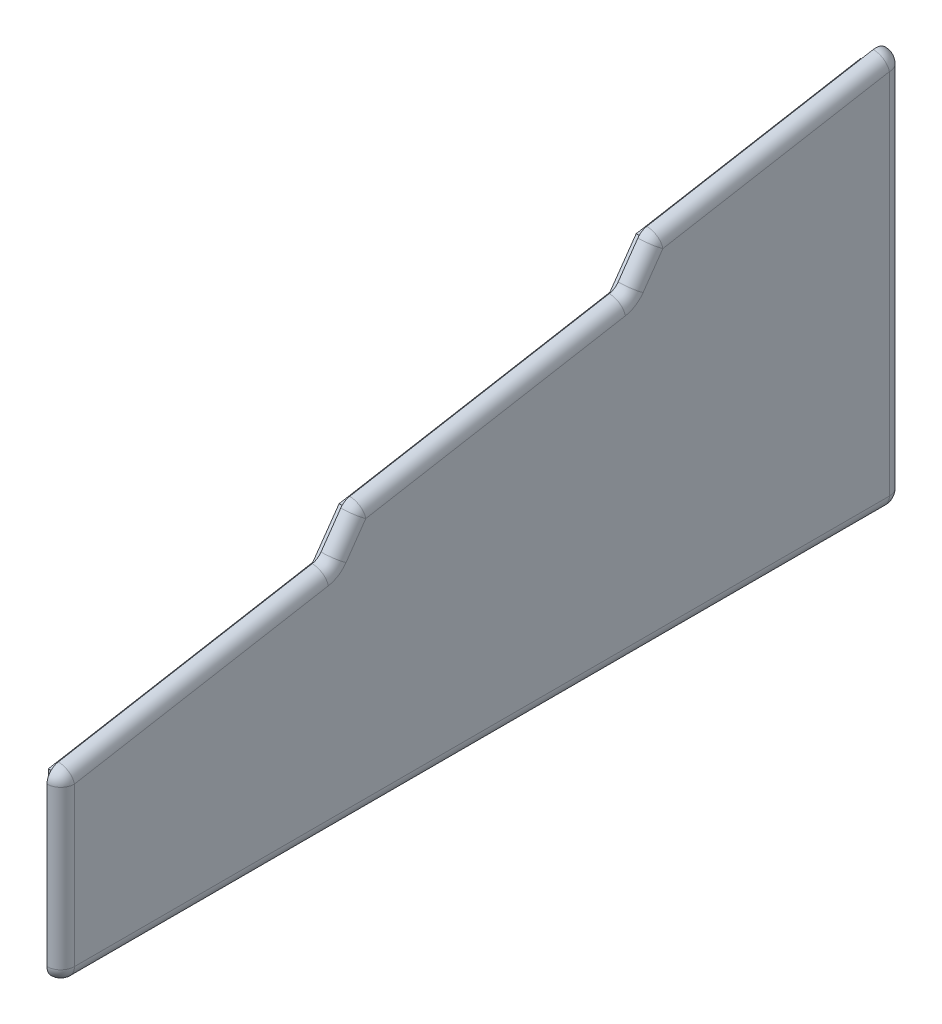
from build123d import *

# Parameters (mm, degrees)
BOSS_EXTRUDE1_DEPTH  = 3
FILLET1_R            = 3
BOSS_EXTRUDE2_DEPTH  = 3
CUT_EXTRUDE1_START   = -16.870694295
CUT_EXTRUDE1_DEPTH   = 17.870694295
CUT_EXTRUDE1_START_2 = 6.082684495
CUT_EXTRUDE1_2_DEPTH = 3.553569774
CUT_EXTRUDE1_START_3 = -94.677172909
CUT_EXTRUDE1_3_DEPTH = 3.677172909
CUT_EXTRUDE2_REACH   = 418.489


with BuildPart() as part:
    # Sketch1 → Boss-Extrude1 (new body)
    with BuildSketch(Plane.ZY.offset(376.423184311)):
        with BuildLine():
            Line((-33.382889261, -4.0880098), (-33.382889261, -11.0880098))
            ThreePointArc((-33.382889261, -11.0880098), (-32.504209605, -13.209330144), (-30.382889261, -14.0880098))
            Line((-30.382889261, -14.0880098), (147.429996243, -14.0880098))
            ThreePointArc((147.429996243, -14.0880098), (149.551316587, -13.209330144), (150.429996243, -11.0880098))
            Line((150.429996243, -11.0880098), (150.429996243, -4.0880098))
            Line((150.429996243, -4.0880098), (150.429996243, 23.394691306))
            ThreePointArc((150.429996243, 23.394691306), (149.728129572, 25.323054136), (147.950940776, 26.349114566))
            Line((147.950940776, 26.349114566), (92.565293245, 36.115098569))
            ThreePointArc((92.565293245, 36.115098569), (91.474338953, 36.539347491), (90.628781645, 37.348792519))
            Line((90.628781645, 37.348792519), (86.318516116, 43.504489644))
            ThreePointArc((86.318516116, 43.504489644), (85.472958808, 44.313934672), (84.382004516, 44.738183594))
            Line((84.382004516, 44.738183594), (27.741063701, 54.725509672))
            ThreePointArc((27.741063701, 54.725509672), (26.650109409, 55.149758594), (25.804552101, 55.959203622))
            Line((25.804552101, 55.959203622), (21.494286572, 62.114900747))
            ThreePointArc((21.494286572, 62.114900747), (20.648729264, 62.924345775), (19.557774972, 63.348594697))
            Line((19.557774972, 63.348594697), (-29.861944728, 72.062624659))
            ThreePointArc((-29.861944728, 72.062624659), (-32.31125209, 71.406334729), (-33.382889261, 69.1082014))
            Line((-33.382889261, 69.1082014), (-33.382889261, -4.0880098))
        make_face()
    extrude(amount=BOSS_EXTRUDE1_DEPTH)

    # Fillet1
    fillet1_edges = [part.edges().sort_by_distance(p)[0] for p in [
        (-379.423184311, 67.705609678, -5.152084878),
        (-379.423184311, 62.924345775, 20.648729264),
        (-379.423184311, 59.037052184, 23.649419336),
        (-379.423184311, 55.149758594, 26.650109409),
        (-379.423184311, 49.731846633, 56.061534109),
        (-379.423184311, 44.313934672, 85.472958808),
        (-379.423184311, 40.426641081, 88.473648881),
        (-379.423184311, 36.539347491, 91.474338953),
        (-379.423184311, 31.232106567, 120.258117011),
        (-379.423184311, 25.323054136, 149.728129572),
        (-379.423184311, 6.153340753, 150.429996243),
        (-379.423184311, -13.209330144, 149.551316587),
        (-379.423184311, -14.0880098, 58.523553491),
        (-379.423184311, -13.209330144, -32.504209605),
        (-379.423184311, 29.0100958, -33.382889261),
        (-379.423184311, 71.406334729, -32.31125209),
    ]]
    fillet(fillet1_edges, radius=FILLET1_R - 0.0001)  # a hair under: the kernel refuses the full size

    # Sketch2 → Boss-Extrude2 (add)
    with BuildSketch(Plane(origin=(-376.423184311, 0, 0), x_dir=(0, 0, -1), z_dir=(1, 0, 0))):
        Polygon((-147.129996243, 23.142961417), (-147.129996243, 13.236254269), (-143.529996243, 9.636254269), (-143.529996243, -4.0880098), (-143.529996243, -10.7880098), (26.482889261, -10.7880098), (26.482889261, -4.0880098), (26.482889261, 9.636254269), (30.082889261, 13.236254269), (30.082889261, 68.750675322), (-18.862359767, 60.120307341), (-24.598124131, 51.928786898), (-83.686589311, 41.509896238), (-89.422353675, 33.318375795), align=None)
    extrude(amount=BOSS_EXTRUDE2_DEPTH)

    # Cut-Extrude1: read off the stored shape, not the designer's step
    # Cut-Extrude1 outline → Cut-Extrude1 (cut)
    with BuildSketch(Plane.XZ.offset(10.7880098).offset(CUT_EXTRUDE1_START)):
        with BuildLine():
            Line((-376.423184311, 143.529996243), (-376.423184311, 142.329996243))
            ThreePointArc((-376.423184311, 142.329996243), (-375.230428102, 140.761580148), (-373.423184311, 139.97642647))
            Line((-373.423184311, 139.97642647), (-373.423184311, 143.529996243))
            Line((-373.423184311, 143.529996243), (-376.423184311, 143.529996243))
        make_face()
    extrude(amount=CUT_EXTRUDE1_DEPTH, mode=Mode.SUBTRACT)

    # Cut-Extrude1 2 outline → Cut-Extrude1 2 (cut)
    with BuildSketch(Plane(origin=(0, 0, 0), x_dir=(1, 0, 0), z_dir=(0, 1, 0)).offset(CUT_EXTRUDE1_START_2)):
        with BuildLine():
            ThreePointArc((-373.423184311, -139.97642647), (-375.230428102, -140.761580148), (-376.423184311, -142.329996243))
            Line((-376.423184311, -142.329996243), (-376.423184311, -143.529996243))
            Line((-376.423184311, -143.529996243), (-373.423184311, -143.529996243))
            Line((-373.423184311, -143.529996243), (-373.423184311, -139.97642647))
        make_face()
    extrude(amount=CUT_EXTRUDE1_2_DEPTH, mode=Mode.SUBTRACT)

    # Cut-Extrude1 3 outline → Cut-Extrude1 3 (add)
    with BuildSketch(Plane(origin=(0, 0, 0), x_dir=(1, 0, 0), z_dir=(0, 0.707106781186553, -0.707106781186542)).offset(CUT_EXTRUDE1_START_3)):
        with BuildLine():
            Line((-376.423184311, -106.607838111), (-376.423184311, -113.39606321))
            Line((-376.423184311, -113.39606321), (-373.423184311, -113.39606321))
            Line((-373.423184311, -113.39606321), (-373.423184311, -103.279387817))
            add(Edge.make_bspline(
                [(-373.423184311, -103.279387817), (-375.582623677, -103.754880716), (-376.423184311, -106.607838111)],
                knots=[0.154459598, 0.154459598, 0.154459598, 1.176005207, 1.176005207, 1.176005207], degree=2, weights=[1, 0.872366982, 1]))
        make_face()
    extrude(amount=CUT_EXTRUDE1_3_DEPTH)

    # Cut-Extrude2: up to this plane
    cut_extrude2_end = Plane(origin=(-373.423184311, -8.423317496, -8.423317496), z_dir=(0, 0.7071067811865445, 0.7071067811865507))
    # Sketch3<3> → Cut-Extrude2 (cut, up to the surface)
    with BuildSketch(Plane.XZ.offset(10.7880098), mode=Mode.PRIVATE) as cut_extrude2_sk1:
        with BuildLine():
            Line((-373.423184311, -26.482889261), (-373.423184311, -23.233241391))
            ThreePointArc((-373.423184311, -23.233241391), (-375.473428882, -24.346456682), (-376.410662534, -26.482889261))
            Line((-376.410662534, -26.482889261), (-373.423184311, -26.482889261))
        make_face()
    cut_extrude2_tool1 = split(extrude(cut_extrude2_sk1.sketch, amount=-CUT_EXTRUDE2_REACH, mode=Mode.PRIVATE), bisect_by=cut_extrude2_end, keep=Keep.BOTH, mode=Mode.PRIVATE)
    add(cut_extrude2_tool1.solids().sort_by_distance((-374.649681, -10.78801, -25.160842))[0], mode=Mode.SUBTRACT)
    # Sketch3<3> → Cut-Extrude2 (cut, up to the surface)
    with BuildSketch(Plane.XZ.offset(10.7880098), mode=Mode.PRIVATE) as cut_extrude2_sk2:
        with BuildLine():
            ThreePointArc((-373.473184311, -22.937437402), (-375.250304231, -23.730170981), (-376.423184311, -25.282889261))
            Line((-376.423184311, -25.282889261), (-376.423184311, -26.482889261))
            Line((-376.423184311, -26.482889261), (-376.410662534, -26.482889261))
            ThreePointArc((-376.410662534, -26.482889261), (-375.473428882, -24.346456682), (-373.423184311, -23.233241391))
            Line((-373.423184311, -23.233241391), (-373.423184311, -22.929319487))
            ThreePointArc((-373.423184311, -22.929319487), (-373.448197491, -22.933297266), (-373.473184311, -22.937437402))
        make_face()
    cut_extrude2_tool2 = split(extrude(cut_extrude2_sk2.sketch, amount=-CUT_EXTRUDE2_REACH, mode=Mode.PRIVATE), bisect_by=cut_extrude2_end, keep=Keep.BOTH, mode=Mode.PRIVATE)
    add(cut_extrude2_tool2.solids().sort_by_distance((-373.46969, -10.78801, -23.08128))[0], mode=Mode.SUBTRACT)


with BuildPart() as body_2:
    # Mirror1: mirrored copy
    add(part.part.mirror(Plane(origin=(-373.423184311, 0, 0), x_dir=(0, 0, 1), z_dir=(1, 0, 0))))


solid = body_2.part
